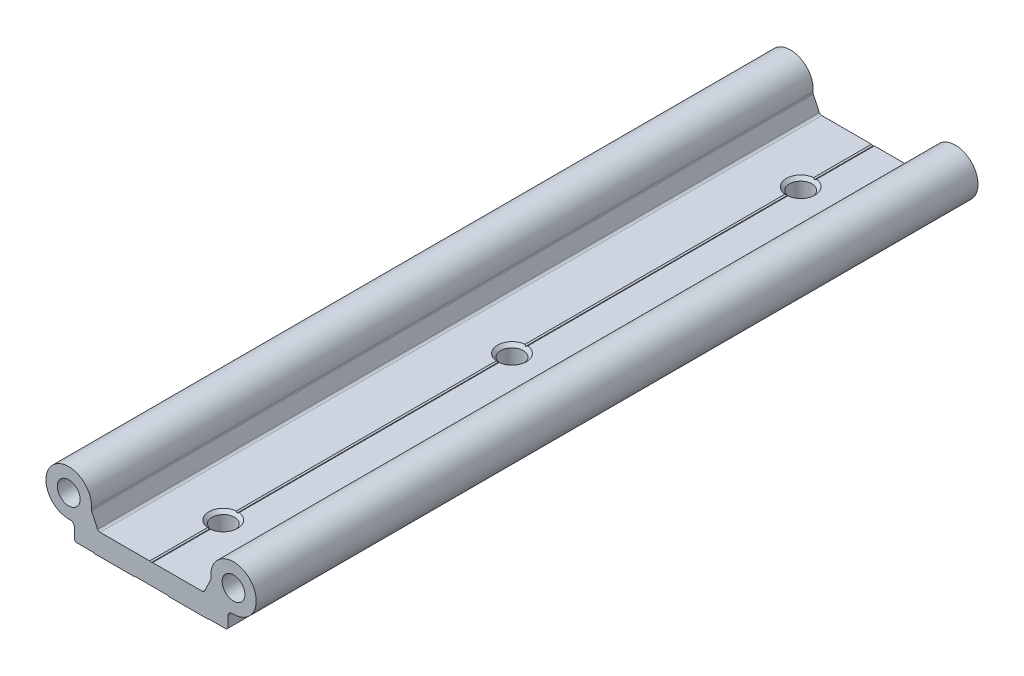
from build123d import *

# Parameters (mm, degrees)
MODEL_R                           = 3.999999997
BOSS_EXTRUDE1_DEPTH               = 254
F_3_8_16_TAPPED_HOLE1_D           = 7.9375
F_3_8_16_TAPPED_HOLE1_CSINK_D     = 10.16
F_3_8_16_TAPPED_HOLE1_CSINK_ANGLE = 90


with BuildPart() as part:
    # Model → Boss-Extrude1 (new body)
    with BuildSketch(Plane.XY):
        with BuildLine():
            Line((-18.843780991, 7.981867858), (-20.966888929, 12.534890876))
            ThreePointArc((-20.966888929, 12.534890876), (-21.047789267, 12.798072701), (-21.053849819, 13.07334131))
            ThreePointArc((-21.053849819, 13.07334131), (-34.474612004, 19.833405747), (-28.578947374, 6.011088019))
            ThreePointArc((-28.578947374, 6.011088019), (-27.4676292, 5.601381399), (-27.000000001, 4.513167022))
            Line((-27.000000001, 4.513167022), (-27.000000001, 0.700000022))
            Line((-27.000000001, 0.700000022), (-26.500000001, 0.200000022))
            Line((-26.500000001, 0.200000022), (-20.200001001, 0.200000022))
            Line((-20.200001001, 0.200000022), (-20.000000979, 0))
            Line((-20.000000979, 0), (-6.000000502, 0))
            Line((-6.000000502, 0), (-5.80000048, 0.200000022))
            Line((-5.80000048, 0.200000022), (5.80000048, 0.200000022))
            Line((5.80000048, 0.200000022), (6.000000502, 0))
            Line((6.000000502, 0), (20.000000979, 0))
            Line((20.000000979, 0), (20.200001001, 0.200000022))
            Line((20.200001001, 0.200000022), (26.500000001, 0.200000022))
            Line((26.500000001, 0.200000022), (27.000000001, 0.700000022))
            Line((27.000000001, 0.700000022), (27.000000001, 4.513167022))
            ThreePointArc((27.000000001, 4.513167022), (27.4676292, 5.601381399), (28.578947374, 6.011088019))
            ThreePointArc((28.578947374, 6.011088019), (34.474612004, 19.833405747), (21.053849819, 13.07334131))
            ThreePointArc((21.053849819, 13.07334131), (21.047789267, 12.798072701), (20.966888929, 12.534890876))
            Line((20.966888929, 12.534890876), (18.843780991, 7.981867858))
            ThreePointArc((18.843780991, 7.981867858), (18.479330527, 7.628755749), (17.98848008, 7.499999621))
            Line((17.98848008, 7.499999621), (0.500000254, 7.499999621))
            Line((0.500000254, 7.499999621), (0, 7.211324621))
            Line((0, 7.211324621), (-0.500000254, 7.499999621))
            Line((-0.500000254, 7.499999621), (-17.98848008, 7.499999621))
            ThreePointArc((-17.98848008, 7.499999621), (-18.479330527, 7.628755749), (-18.843780991, 7.981867858))
        make_face()
        with Locations((-29.000000026, 13.999999962)):
            Circle(MODEL_R, mode=Mode.SUBTRACT)
        with Locations((29.000000026, 13.999999962)):
            Circle(MODEL_R, mode=Mode.SUBTRACT)
    extrude(amount=BOSS_EXTRUDE1_DEPTH)

    # 3/8-16 Tapped Hole1 (through all)
    with Locations(Plane(origin=(0, 7.499999621, 0), x_dir=(1, 0, 0), z_dir=(0, 1, 0))):
        with Locations((0, -25.4), (0, -127), (0, -228.6), (0, -330.2), (0, -431.8), (0, -533.4), (0, -635), (0, -736.6), (0, -838.2), (0, -939.8), (0, -1041.4), (0, -1143), (0, -1244.6), (0, -1346.2), (0, -1447.8), (0, -1549.4), (0, -1651), (0, -1752.6), (0, -1854.2), (0, -1955.8)):
            CounterSinkHole(F_3_8_16_TAPPED_HOLE1_D / 2, F_3_8_16_TAPPED_HOLE1_CSINK_D / 2, counter_sink_angle=F_3_8_16_TAPPED_HOLE1_CSINK_ANGLE)


solid = part.part
